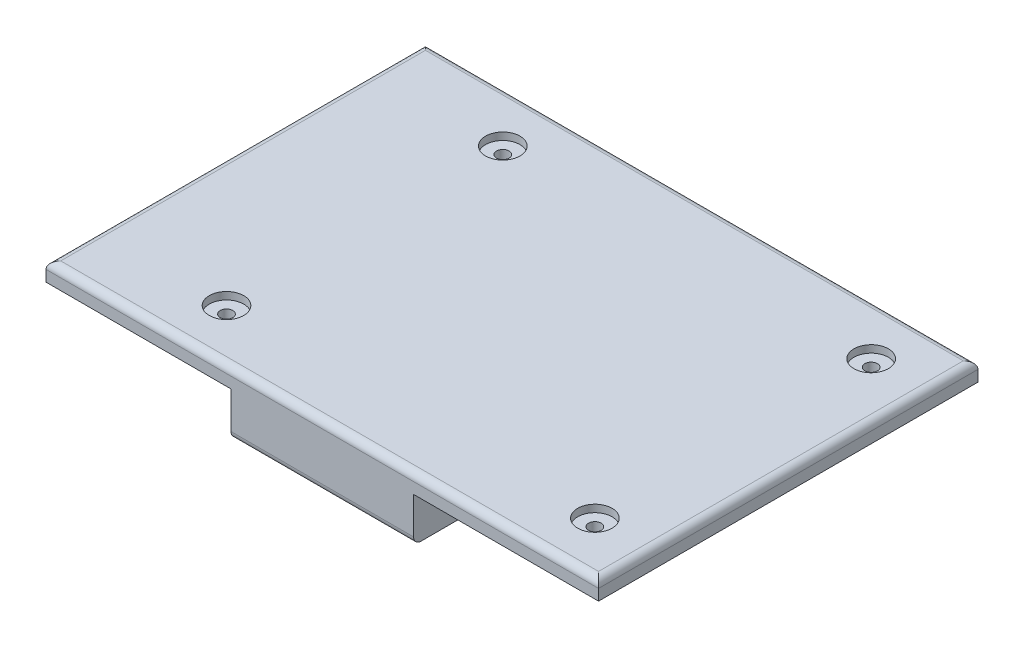
from build123d import *

# Parameters (mm, degrees)
SKETCH1_W                                    = 150
SKETCH1_H                                    = 103
BOSS_EXTRUDE1_DEPTH                          = 5
SKETCH2_W                                    = 49.6
SKETCH2_H                                    = 13.8
BOSS_EXTRUDE2_DEPTH                          = 12
CUT_EXTRUDE1_DEPTH                           = 1.2
FILLET1_R                                    = 2
CBORE_FOR_M3_HEX_HEAD_CAP_SCREW1_D           = 3.4
CBORE_FOR_M3_HEX_HEAD_CAP_SCREW1_CBORE_D     = 9.351
CBORE_FOR_M3_HEX_HEAD_CAP_SCREW1_CBORE_DEPTH = 2


with BuildPart() as part:
    # Sketch1 → Boss-Extrude1 (new body)
    with BuildSketch(Plane(origin=(0, 0, 0), x_dir=(1, 0, 0), z_dir=(0, 1, 0))):
        with Locations((75, 51.5)):
            Rectangle(SKETCH1_W, SKETCH1_H)
    extrude(amount=BOSS_EXTRUDE1_DEPTH)

    # Sketch2 → Boss-Extrude2 (add)
    with BuildSketch(Plane.XZ):
        with Locations((75, -6.9)):
            Rectangle(SKETCH2_W, SKETCH2_H)
        with Locations((75, -96.1)):
            Rectangle(SKETCH2_W, SKETCH2_H)
    extrude(amount=BOSS_EXTRUDE2_DEPTH)

    # Sketch4 → Cut-Extrude1 (cut)
    with BuildSketch(Plane.XZ):
        with BuildLine():
            Line((145.1, -83), (145.1, -20))
            ThreePointArc((145.1, -20), (144.777817459, -19.222182541), (144, -18.9))
            Line((144, -18.9), (6, -18.9))
            ThreePointArc((6, -18.9), (5.222182541, -19.222182541), (4.9, -20))
            Line((4.9, -20), (4.9, -83))
            ThreePointArc((4.9, -83), (5.222182541, -83.777817459), (6, -84.1))
            Line((6, -84.1), (144, -84.1))
            ThreePointArc((144, -84.1), (144.777817459, -83.777817459), (145.1, -83))
        make_face()
    extrude(amount=-CUT_EXTRUDE1_DEPTH, mode=Mode.SUBTRACT)

    # Fillet1
    fillet1_edges = [part.edges().sort_by_distance(p)[0] for p in [
        (75, -12, -89.2),
        (75, -12, -103),
        (75, -12, -13.8),
        (75, -12, 0),
        (150, 5, -51.5),
        (75, 5, -103),
        (75, 5, 0),
        (0, 5, -51.5),
    ]]
    fillet(fillet1_edges, radius=FILLET1_R)

    # CBORE for M3 Hex Head Cap Screw1 (through all)
    with Locations(Plane(origin=(0, 5, 0), x_dir=(1, 0, 0), z_dir=(0, 1, 0))):
        with Locations((35, 89), (35, 14), (135, 14), (135, 89)):
            CounterBoreHole(CBORE_FOR_M3_HEX_HEAD_CAP_SCREW1_D / 2, CBORE_FOR_M3_HEX_HEAD_CAP_SCREW1_CBORE_D / 2, CBORE_FOR_M3_HEX_HEAD_CAP_SCREW1_CBORE_DEPTH)


solid = part.part
